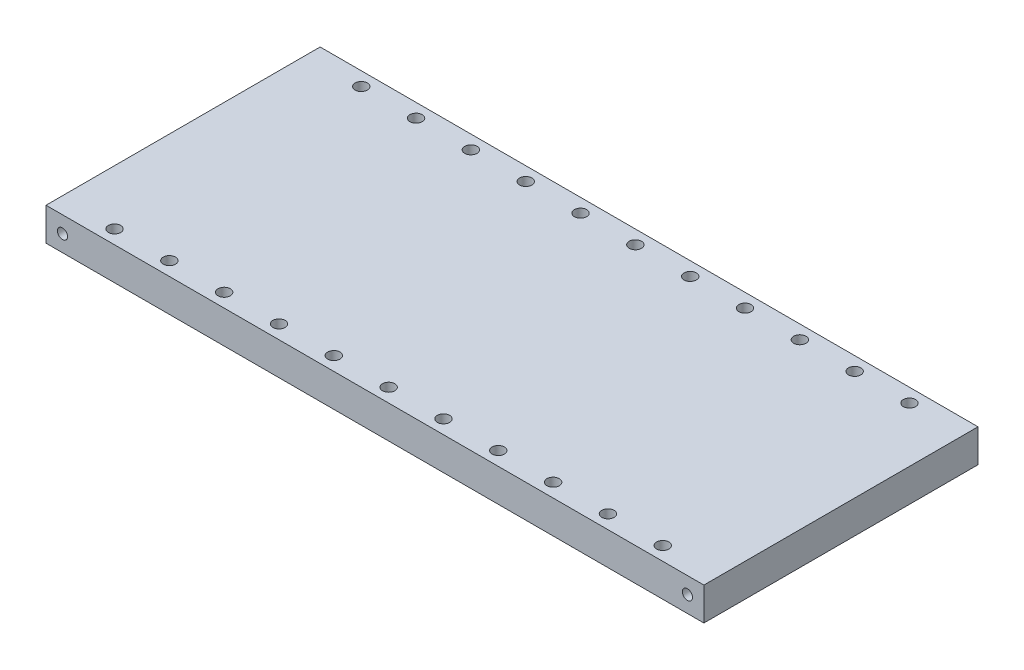
from build123d import *

# Parameters (mm, degrees)
SKETCH2_W           = 240
SKETCH2_H           = 100
BOSS_EXTRUDE1_DEPTH = 12
HOLE1_AT_2_COUNT    = 2
HOLE1_AT_2_PITCH    = 228
SKETCH10_W          = 216
SKETCH10_H          = 76
CUT_EXTRUDE2_DEPTH  = 8
EXTRUDE_THIN1_DEPTH = 8
FILLET1_R           = 1


# Read off the part's stored shape, not the designer's step: CBORE for M4 SHCS1
with BuildPart() as part:
    # Sketch2 → Boss-Extrude1 (new body)
    with BuildSketch(Plane(origin=(0, 0, 0), x_dir=(1, 0, 0), z_dir=(0, 1, 0))):
        Rectangle(SKETCH2_W, SKETCH2_H)
    extrude(amount=BOSS_EXTRUDE1_DEPTH)

    # Sketch6 → Hole1 (revolve, cut)
    with BuildSketch(Plane(origin=(-114, 6, 50), x_dir=(0, -1, 0), z_dir=(1, 0, 0))):
        Polygon((0, 0), (0, 12), (1.85, 10.15), (1.85, 0), align=None)
    hole1 = revolve(axis=Axis((-114, 6, 54.244199587), (0, 0, -1)), mode=Mode.SUBTRACT)

    # Hole1 at 2: Hole1 ×2
    with Locations(*[(i * HOLE1_AT_2_PITCH, 0, 0) for i in range(1, HOLE1_AT_2_COUNT)]):
        add(hole1, mode=Mode.SUBTRACT)

    # Mirror2: Hole1 across plane
    add(hole1.mirror(Plane.XY), mode=Mode.SUBTRACT)

    # Mirror2 copy 1 sketch → Mirror2 copy 1 (revolve, cut)
    with BuildSketch(Plane(origin=(114, 6, -50), x_dir=(0, -1, 0), z_dir=(1, 0, 0))):
        Polygon((0, 0), (0, -12), (1.85, -10.15), (1.85, 0), align=None)
    revolve(axis=Axis((114, 6, -54.244199587), (0, 0, -1)), mode=Mode.SUBTRACT)

    # CBORE for M4 SHCS1 outline → CBORE for M4 SHCS1 (revolve, cut)
    with BuildSketch(Plane(origin=(-100, 0, -45), x_dir=(1, 0, 0), z_dir=(0, 0, 1))):
        Polygon((2.25, 4), (2.25, 12), (0, 12), (0, 0), (4.025, 0), (4, 0.025), (4, 4), align=None)
    revolve(axis=Axis((-100, 0, -45), (0, 1, 0)), mode=Mode.SUBTRACT)

    # CBORE for M4 SHCS1 2 outline → CBORE for M4 SHCS1 2 (revolve, cut)
    with BuildSketch(Plane(origin=(-100, 0, 45), x_dir=(1, 0, 0), z_dir=(0, 0, 1))):
        Polygon((0, 0), (4.025, 0), (4, 0.025), (4, 4), (2.25, 4), (2.25, 12), (0, 12), align=None)
    revolve(axis=Axis((-100, 0, 45), (0, 1, 0)), mode=Mode.SUBTRACT)

    # CBORE for M4 SHCS1 3 outline → CBORE for M4 SHCS1 3 (revolve, cut)
    with BuildSketch(Plane(origin=(-80, 0, -45), x_dir=(1, 0, 0), z_dir=(0, 0, 1))):
        Polygon((0, 0), (4.025, 0), (4, 0.025), (4, 4), (2.25, 4), (2.25, 12), (0, 12), align=None)
    revolve(axis=Axis((-80, 0, -45), (0, 1, 0)), mode=Mode.SUBTRACT)

    # CBORE for M4 SHCS1 4 outline → CBORE for M4 SHCS1 4 (revolve, cut)
    with BuildSketch(Plane(origin=(-80, 0, 45), x_dir=(1, 0, 0), z_dir=(0, 0, 1))):
        Polygon((0, 0), (4.025, 0), (4, 0.025), (4, 4), (2.25, 4), (2.25, 12), (0, 12), align=None)
    revolve(axis=Axis((-80, 0, 45), (0, 1, 0)), mode=Mode.SUBTRACT)

    # CBORE for M4 SHCS1 5 outline → CBORE for M4 SHCS1 5 (revolve, cut)
    with BuildSketch(Plane(origin=(-60, 0, -45), x_dir=(1, 0, 0), z_dir=(0, 0, 1))):
        Polygon((0, 0), (4.025, 0), (4, 0.025), (4, 4), (2.25, 4), (2.25, 12), (0, 12), align=None)
    revolve(axis=Axis((-60, 0, -45), (0, 1, 0)), mode=Mode.SUBTRACT)

    # CBORE for M4 SHCS1 6 outline → CBORE for M4 SHCS1 6 (revolve, cut)
    with BuildSketch(Plane(origin=(-60, 0, 45), x_dir=(1, 0, 0), z_dir=(0, 0, 1))):
        Polygon((0, 0), (4.025, 0), (4, 0.025), (4, 4), (2.25, 4), (2.25, 12), (0, 12), align=None)
    revolve(axis=Axis((-60, 0, 45), (0, 1, 0)), mode=Mode.SUBTRACT)

    # CBORE for M4 SHCS1 7 outline → CBORE for M4 SHCS1 7 (revolve, cut)
    with BuildSketch(Plane(origin=(-40, 0, -45), x_dir=(1, 0, 0), z_dir=(0, 0, 1))):
        Polygon((0, 0), (4.025, 0), (4, 0.025), (4, 4), (2.25, 4), (2.25, 12), (0, 12), align=None)
    revolve(axis=Axis((-40, 0, -45), (0, 1, 0)), mode=Mode.SUBTRACT)

    # CBORE for M4 SHCS1 8 outline → CBORE for M4 SHCS1 8 (revolve, cut)
    with BuildSketch(Plane(origin=(-40, 0, 45), x_dir=(1, 0, 0), z_dir=(0, 0, 1))):
        Polygon((0, 0), (4.025, 0), (4, 0.025), (4, 4), (2.25, 4), (2.25, 12), (0, 12), align=None)
    revolve(axis=Axis((-40, 0, 45), (0, 1, 0)), mode=Mode.SUBTRACT)

    # CBORE for M4 SHCS1 9 outline → CBORE for M4 SHCS1 9 (revolve, cut)
    with BuildSketch(Plane(origin=(-20, 0, -45), x_dir=(1, 0, 0), z_dir=(0, 0, 1))):
        Polygon((0, 0), (4.025, 0), (4, 0.025), (4, 4), (2.25, 4), (2.25, 12), (0, 12), align=None)
    revolve(axis=Axis((-20, 0, -45), (0, 1, 0)), mode=Mode.SUBTRACT)

    # CBORE for M4 SHCS1 10 outline → CBORE for M4 SHCS1 10 (revolve, cut)
    with BuildSketch(Plane(origin=(-20, 0, 45), x_dir=(1, 0, 0), z_dir=(0, 0, 1))):
        Polygon((0, 0), (4.025, 0), (4, 0.025), (4, 4), (2.25, 4), (2.25, 12), (0, 12), align=None)
    revolve(axis=Axis((-20, 0, 45), (0, 1, 0)), mode=Mode.SUBTRACT)

    # CBORE for M4 SHCS1 11 outline → CBORE for M4 SHCS1 11 (revolve, cut)
    with BuildSketch(Plane.XY.offset(-45)):
        Polygon((0, 0), (4.025, 0), (4, 0.025), (4, 4), (2.25, 4), (2.25, 12), (0, 12), align=None)
    revolve(axis=Axis((0, 0, -45), (0, 1, 0)), mode=Mode.SUBTRACT)

    # CBORE for M4 SHCS1 12 outline → CBORE for M4 SHCS1 12 (revolve, cut)
    with BuildSketch(Plane.XY.offset(45)):
        Polygon((0, 0), (4.025, 0), (4, 0.025), (4, 4), (2.25, 4), (2.25, 12), (0, 12), align=None)
    revolve(axis=Axis((0, 0, 45), (0, 1, 0)), mode=Mode.SUBTRACT)

    # CBORE for M4 SHCS1 13 outline → CBORE for M4 SHCS1 13 (revolve, cut)
    with BuildSketch(Plane(origin=(20, 0, -45), x_dir=(1, 0, 0), z_dir=(0, 0, 1))):
        Polygon((0, 0), (4.025, 0), (4, 0.025), (4, 4), (2.25, 4), (2.25, 12), (0, 12), align=None)
    revolve(axis=Axis((20, 0, -45), (0, 1, 0)), mode=Mode.SUBTRACT)

    # CBORE for M4 SHCS1 14 outline → CBORE for M4 SHCS1 14 (revolve, cut)
    with BuildSketch(Plane(origin=(20, 0, 45), x_dir=(1, 0, 0), z_dir=(0, 0, 1))):
        Polygon((0, 0), (4.025, 0), (4, 0.025), (4, 4), (2.25, 4), (2.25, 12), (0, 12), align=None)
    revolve(axis=Axis((20, 0, 45), (0, 1, 0)), mode=Mode.SUBTRACT)

    # CBORE for M4 SHCS1 15 outline → CBORE for M4 SHCS1 15 (revolve, cut)
    with BuildSketch(Plane(origin=(40, 0, -45), x_dir=(1, 0, 0), z_dir=(0, 0, 1))):
        Polygon((0, 0), (4.025, 0), (4, 0.025), (4, 4), (2.25, 4), (2.25, 12), (0, 12), align=None)
    revolve(axis=Axis((40, 0, -45), (0, 1, 0)), mode=Mode.SUBTRACT)

    # CBORE for M4 SHCS1 16 outline → CBORE for M4 SHCS1 16 (revolve, cut)
    with BuildSketch(Plane(origin=(40, 0, 45), x_dir=(1, 0, 0), z_dir=(0, 0, 1))):
        Polygon((0, 0), (4.025, 0), (4, 0.025), (4, 4), (2.25, 4), (2.25, 12), (0, 12), align=None)
    revolve(axis=Axis((40, 0, 45), (0, 1, 0)), mode=Mode.SUBTRACT)

    # CBORE for M4 SHCS1 17 outline → CBORE for M4 SHCS1 17 (revolve, cut)
    with BuildSketch(Plane(origin=(60, 0, -45), x_dir=(1, 0, 0), z_dir=(0, 0, 1))):
        Polygon((0, 0), (4.025, 0), (4, 0.025), (4, 4), (2.25, 4), (2.25, 12), (0, 12), align=None)
    revolve(axis=Axis((60, 0, -45), (0, 1, 0)), mode=Mode.SUBTRACT)

    # CBORE for M4 SHCS1 18 outline → CBORE for M4 SHCS1 18 (revolve, cut)
    with BuildSketch(Plane(origin=(60, 0, 45), x_dir=(1, 0, 0), z_dir=(0, 0, 1))):
        Polygon((0, 0), (4.025, 0), (4, 0.025), (4, 4), (2.25, 4), (2.25, 12), (0, 12), align=None)
    revolve(axis=Axis((60, 0, 45), (0, 1, 0)), mode=Mode.SUBTRACT)

    # CBORE for M4 SHCS1 19 outline → CBORE for M4 SHCS1 19 (revolve, cut)
    with BuildSketch(Plane(origin=(80, 0, -45), x_dir=(1, 0, 0), z_dir=(0, 0, 1))):
        Polygon((0, 0), (4.025, 0), (4, 0.025), (4, 4), (2.25, 4), (2.25, 12), (0, 12), align=None)
    revolve(axis=Axis((80, 0, -45), (0, 1, 0)), mode=Mode.SUBTRACT)

    # CBORE for M4 SHCS1 20 outline → CBORE for M4 SHCS1 20 (revolve, cut)
    with BuildSketch(Plane(origin=(80, 0, 45), x_dir=(1, 0, 0), z_dir=(0, 0, 1))):
        Polygon((0, 0), (4.025, 0), (4, 0.025), (4, 4), (2.25, 4), (2.25, 12), (0, 12), align=None)
    revolve(axis=Axis((80, 0, 45), (0, 1, 0)), mode=Mode.SUBTRACT)

    # CBORE for M4 SHCS1 21 outline → CBORE for M4 SHCS1 21 (revolve, cut)
    with BuildSketch(Plane(origin=(100, 0, -45), x_dir=(1, 0, 0), z_dir=(0, 0, 1))):
        Polygon((0, 0), (4.025, 0), (4, 0.025), (4, 4), (2.25, 4), (2.25, 12), (0, 12), align=None)
    revolve(axis=Axis((100, 0, -45), (0, 1, 0)), mode=Mode.SUBTRACT)

    # CBORE for M4 SHCS1 22 outline → CBORE for M4 SHCS1 22 (revolve, cut)
    with BuildSketch(Plane(origin=(100, 0, 45), x_dir=(1, 0, 0), z_dir=(0, 0, 1))):
        Polygon((0, 0), (4.025, 0), (4, 0.025), (4, 4), (2.25, 4), (2.25, 12), (0, 12), align=None)
    revolve(axis=Axis((100, 0, 45), (0, 1, 0)), mode=Mode.SUBTRACT)

    # Sketch10 → Cut-Extrude2 (cut)
    with BuildSketch(Plane.XZ):
        Rectangle(SKETCH10_W, SKETCH10_H)
    extrude(amount=-CUT_EXTRUDE2_DEPTH, mode=Mode.SUBTRACT)

    # Sketch11 → Extrude-Thin1 (add)
    with BuildSketch(Plane.XZ):
        Polygon((-107.336187577, -39.886624782), (108.663812423, 36.113375218), (107.336187577, 39.886624782), (-108.663812423, -36.113375218), align=None)
        Polygon((-108.663812423, 36.113375218), (107.336187577, -39.886624782), (108.663812423, -36.113375218), (-107.336187577, 39.886624782), align=None)
    extrude(amount=-EXTRUDE_THIN1_DEPTH)

    # Fillet1
    fillet1_edges = [part.edges().sort_by_distance(p)[0] for p in [
        (101.974201355, 4, 38),
        (6.025798645, 4, 0),
        (-108, 4, -35.879811588),
        (-6.025798645, 4, 0),
        (0, 4, -2.120188412),
        (108, 4, -35.879811588),
        (-101.974201355, 4, 38),
        (0, 4, 2.120188412),
        (108, 4, 35.879811588),
        (-101.974201355, 4, -38),
        (101.974201355, 4, -38),
        (-108, 4, 35.879811588),
    ]]
    fillet(fillet1_edges, radius=FILLET1_R)


solid = part.part
